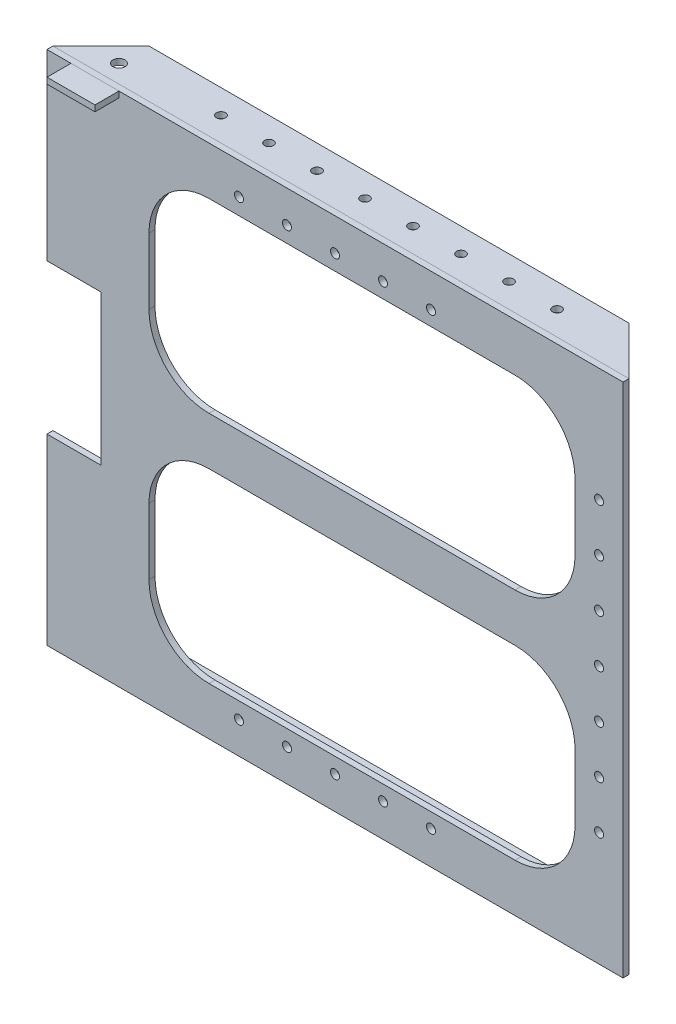
from build123d import *

# Parameters (mm, degrees)
SKETCH1_W           = 304.8
SKETCH1_H           = 273.05
BOSS_EXTRUDE1_DEPTH = 3.175
SKETCH2_W           = 28.575
SKETCH2_H           = 79.375
CUT_EXTRUDE1_DEPTH  = 3.175
SKETCH4_W           = 304.8
SKETCH4_H           = 3.175
BASE_FLANGE1_DEPTH  = 25.4
SKETCH9_W           = 304.8
SKETCH9_H           = 3.175
BASE_FLANGE2_DEPTH  = 25.4
SKETCH12_W          = 25.4
SKETCH12_H          = 3.175
BASE_FLANGE3_DEPTH  = 12.7
CHAMFER1_SIZE       = 25.4
CHAMFER2_SIZE       = 25.4
SKETCH15_R          = 3.175
CUT_EXTRUDE3_DEPTH  = 3.175
SKETCH17_R          = 2.38125
CUT_EXTRUDE5_DEPTH  = 411.005490817
SKETCH18_R          = 2.38125
CUT_EXTRUDE6_DEPTH  = 411.214423351
SKETCH19_R          = 2.38125
CUT_EXTRUDE8_DEPTH  = 411.005490817


# Sheet-metal steps are written as plain solids
with BuildPart() as part:
    # Sketch1 → Boss-Extrude1 (new body)
    with BuildSketch(Plane.XY):
        with Locations((152.4, 136.525)):
            Rectangle(SKETCH1_W, SKETCH1_H)
    extrude(amount=BOSS_EXTRUDE1_DEPTH)

    # Sketch2 → Cut-Extrude1 (cut)
    with BuildSketch(Plane.XY.offset(3.175)):
        with Locations((14.2875, 136.525)):
            Rectangle(SKETCH2_W, SKETCH2_H)
        with BuildLine():
            Line((85.725, 247.65), (247.65, 247.65))
            ThreePointArc((247.65, 247.65), (270.100640303, 238.350640303), (279.4, 215.9))
            Line((279.4, 215.9), (279.4, 180.975))
            ThreePointArc((279.4, 180.975), (270.100640303, 158.524359697), (247.65, 149.225))
            Line((247.65, 149.225), (85.725, 149.225))
            ThreePointArc((85.725, 149.225), (63.274359697, 158.524359697), (53.975, 180.975))
            Line((53.975, 180.975), (53.975, 215.9))
            ThreePointArc((53.975, 215.9), (63.274359697, 238.350640303), (85.725, 247.65))
        make_face()
        with BuildLine():
            Line((85.725, 123.825), (247.65, 123.825))
            ThreePointArc((247.65, 123.825), (270.100640303, 114.525640303), (279.4, 92.075))
            Line((279.4, 92.075), (279.4, 57.15))
            ThreePointArc((279.4, 57.15), (270.100640303, 34.699359697), (247.65, 25.4))
            Line((247.65, 25.4), (85.725, 25.4))
            ThreePointArc((85.725, 25.4), (63.274359697, 34.699359697), (53.975, 57.15))
            Line((53.975, 57.15), (53.975, 92.075))
            ThreePointArc((53.975, 92.075), (63.274359697, 114.525640303), (85.725, 123.825))
        make_face()
    extrude(amount=-CUT_EXTRUDE1_DEPTH, mode=Mode.SUBTRACT)

    # Sketch18 → Cut-Extrude6 (cut, through all)
    with BuildSketch(Plane.XY.offset(3.175)):
        with Locations((292.1, 136.525)):
            Circle(SKETCH18_R)
        with Locations((292.1, 161.925)):
            Circle(SKETCH18_R)
        with Locations((292.1, 111.125)):
            Circle(SKETCH18_R)
        with Locations((292.1, 85.725)):
            Circle(SKETCH18_R)
        with Locations((292.1, 60.325)):
            Circle(SKETCH18_R)
        with Locations((292.1, 187.325)):
            Circle(SKETCH18_R)
        with Locations((292.1, 212.725)):
            Circle(SKETCH18_R)
    extrude(amount=-CUT_EXTRUDE6_DEPTH, mode=Mode.SUBTRACT)

    # Sketch19 → Cut-Extrude8 (cut, through all)
    with BuildSketch(Plane(origin=(0, 0, 0), x_dir=(-1, 0, 0), z_dir=(0, 0, -1))):
        with Locations((-152.4, 255.844541753)):
            Circle(SKETCH19_R)
        with Locations((-127, 256.066204195)):
            Circle(SKETCH19_R)
        with Locations((-101.6, 256.287866637)):
            Circle(SKETCH19_R)
        with Locations((-177.8, 255.622879311)):
            Circle(SKETCH19_R)
        with Locations((-203.2, 255.401216869)):
            Circle(SKETCH19_R)
        with Locations((-101.6, 16.762133363)):
            Circle(SKETCH19_R)
        with Locations((-127, 16.983795805)):
            Circle(SKETCH19_R)
        with Locations((-152.4, 17.205458247)):
            Circle(SKETCH19_R)
        with Locations((-177.8, 17.427120689)):
            Circle(SKETCH19_R)
        with Locations((-203.2, 17.648783131)):
            Circle(SKETCH19_R)
    extrude(amount=-CUT_EXTRUDE8_DEPTH, mode=Mode.SUBTRACT)


with BuildPart() as body_2:
    # Sketch4 → Base-Flange1 (new body)
    with BuildSketch(Plane(origin=(0, 0, 0), x_dir=(-1, 0, 0), z_dir=(0, 0, -1))):
        with Locations((-152.4, 271.4625)):
            Rectangle(SKETCH4_W, SKETCH4_H)
    extrude(amount=BASE_FLANGE1_DEPTH)

    # Chamfer1
    chamfer1_edges = [body_2.edges().sort_by_distance(p)[0] for p in [
        (304.8, 271.4625, -25.4),
        (0, 271.4625, -25.4),
    ]]
    chamfer(chamfer1_edges, length=CHAMFER1_SIZE - 0.0001)  # a hair under: the kernel refuses the full size

    # Sketch15 → Cut-Extrude3 (cut)
    with BuildSketch(Plane(origin=(0, 273.05, 0), x_dir=(1, 0, 0), z_dir=(0, 1, 0))):
        with Locations(Location((25.4, 9.525, 0), (0, 0, 270))):
            Circle(SKETCH15_R)
    extrude(amount=-CUT_EXTRUDE3_DEPTH, mode=Mode.SUBTRACT)


with BuildPart() as body_3:
    # Sketch9 → Base-Flange2 (new body)
    with BuildSketch(Plane(origin=(0, 0, 0), x_dir=(-1, 0, 0), z_dir=(0, 0, -1))):
        with Locations((-152.4, 1.5875)):
            Rectangle(SKETCH9_W, SKETCH9_H)
    extrude(amount=BASE_FLANGE2_DEPTH)

    # Chamfer2
    chamfer2_edges = [body_3.edges().sort_by_distance(p)[0] for p in [
        (0, 1.5875, -25.4),
        (304.8, 1.5875, -25.4),
    ]]
    chamfer(chamfer2_edges, length=CHAMFER2_SIZE - 0.0001)  # a hair under: the kernel refuses the full size


with BuildPart() as body_4:
    # Sketch12 → Base-Flange3 (new body)
    with BuildSketch(Plane.XY.offset(3.175)):
        with Locations((25.4, 271.4625)):
            Rectangle(SKETCH12_W, SKETCH12_H)
    extrude(amount=BASE_FLANGE3_DEPTH)


with BuildPart() as cut_extrude5_tool:
    # Sketch17 → Cut-Extrude5 (new, through all)
    with BuildSketch(Plane(origin=(0, 273.05, 0), x_dir=(1, 0, 0), z_dir=(0, 1, 0))):
        with Locations(Location((76.2, 12.7, 0), (0, 0, 270))):
            Circle(SKETCH17_R)
        with Locations(Location((101.6, 12.7, 0), (0, 0, 270))):
            Circle(SKETCH17_R)
        with Locations(Location((127, 12.7, 0), (0, 0, 270))):
            Circle(SKETCH17_R)
        with Locations(Location((152.4, 12.7, 0), (0, 0, 270))):
            Circle(SKETCH17_R)
        with Locations(Location((177.8, 12.7, 0), (0, 0, 270))):
            Circle(SKETCH17_R)
        with Locations(Location((203.2, 12.7, 0), (0, 0, 270))):
            Circle(SKETCH17_R)
        with Locations(Location((228.6, 12.7, 0), (0, 0, 270))):
            Circle(SKETCH17_R)
        with Locations(Location((254, 12.7, 0), (0, 0, 270))):
            Circle(SKETCH17_R)
    extrude(amount=-CUT_EXTRUDE5_DEPTH)


with BuildPart() as body_2_1:
    add(body_2.part)

    # Cut-Extrude5: cut by cut_extrude5_tool
    add(cut_extrude5_tool.part, mode=Mode.SUBTRACT)


with BuildPart() as body_3_1:
    add(body_3.part)

    # Cut-Extrude5: cut by cut_extrude5_tool
    add(cut_extrude5_tool.part, mode=Mode.SUBTRACT)


solid = Compound([part.part, body_4.part, body_2_1.part, body_3_1.part])
